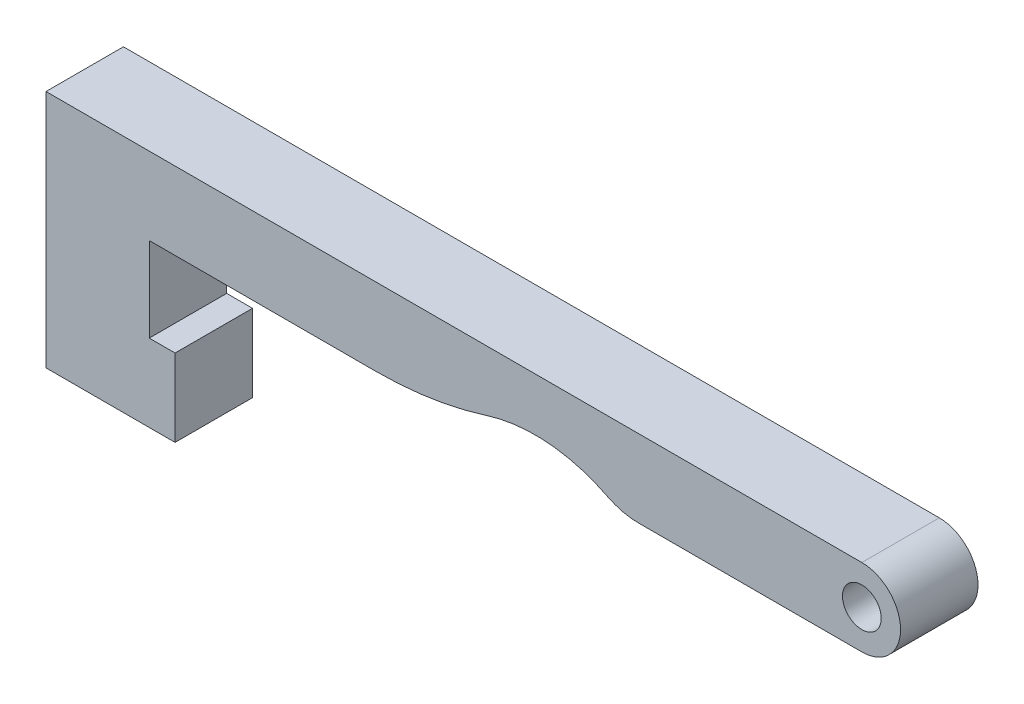
from build123d import *

# Parameters (mm, degrees)
SKETCH1_R           = 7.5
BOSS_EXTRUDE1_DEPTH = 30


with BuildPart() as part:
    # Sketch1 → Boss-Extrude1 (new body)
    with BuildSketch(Plane.XY):
        with BuildLine():
            Line((50, 0), (0, 0))
            Line((0, 0), (0, 92.734246443))
            Line((0, 92.734246443), (316.053358226, 92.734246443))
            ThreePointArc((316.053358226, 92.734246443), (331.053358226, 77.734246443), (316.053358226, 62.734246443))
            Line((316.053358226, 62.734246443), (229.556611721, 62.734246443))
            ThreePointArc((229.556611721, 62.734246443), (223.419141682, 63.456095631), (217.61663489, 65.582247002))
            ThreePointArc((217.61663489, 65.582247002), (194.5220887, 72.08395198), (170.683721289, 69.370564694))
            ThreePointArc((170.683721289, 69.370564694), (149.507784919, 64.403151309), (127.821147709, 62.734246443))
            Line((127.821147709, 62.734246443), (40, 62.734246443))
            Line((40, 62.734246443), (40, 30))
            Line((40, 30), (50, 30))
            Line((50, 30), (50, 0))
        make_face()
        with Locations((316.053358226, 77.734246443)):
            Circle(SKETCH1_R, mode=Mode.SUBTRACT)
    extrude(amount=BOSS_EXTRUDE1_DEPTH)


solid = part.part
